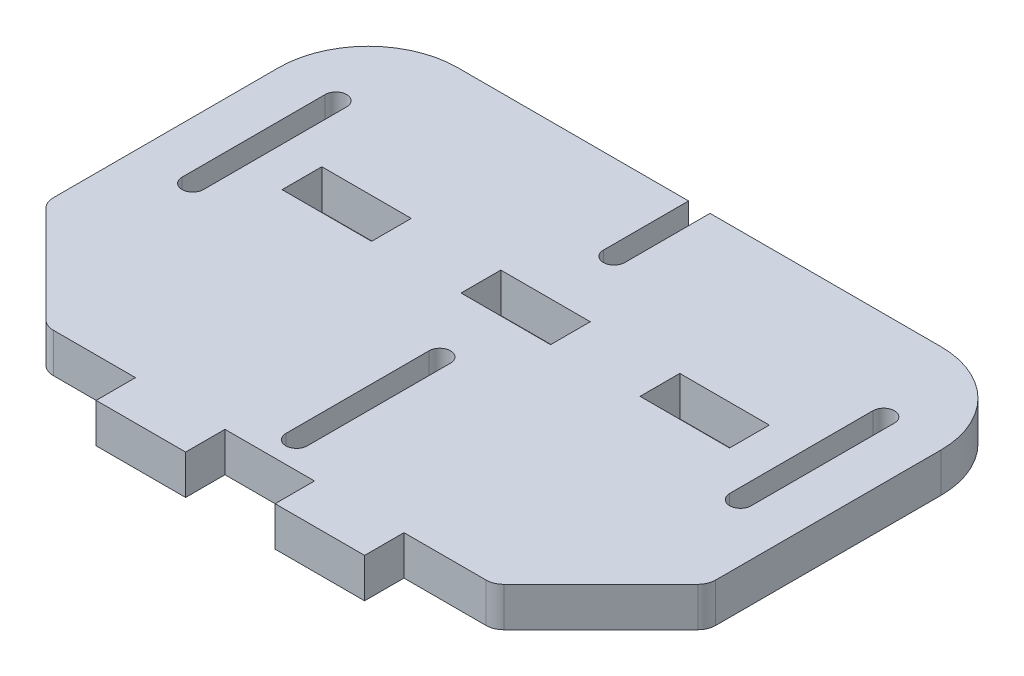
from build123d import *

# Parameters (mm, degrees)
BOSS_EXTRUDE6_DEPTH = 11
SKETCH4_W           = 25
SKETCH4_H           = 11
SKETCH4_H_2         = 11.1
CUT_EXTRUDE1_DEPTH  = 199.489924177
FILLET1_R           = 25
FILLET2_R           = 5


with BuildPart() as part:
    # Sketch1 → Boss-Extrude6 (new body)
    with BuildSketch(Plane(origin=(0, 0, 0), x_dir=(1, 0, 0), z_dir=(0, 1, 0))):
        with BuildLine():
            Line((0, -7.5), (125, -7.5))
            Line((125, -7.5), (125, 3.5))
            Line((125, 3.5), (155, 33.5))
            Line((155, 33.5), (155, 123.5))
            Line((155, 123.5), (65.5, 123.5))
            Line((65.5, 123.5), (65.5, 99.705746838))
            ThreePointArc((65.5, 99.705746838), (62.5, 96.705746838), (59.5, 99.705746838))
            Line((59.5, 99.705746838), (59.5, 123.5))
            Line((59.5, 123.5), (-30, 123.5))
            Line((-30, 123.5), (-30, 33.5))
            Line((-30, 33.5), (0, 3.5))
            Line((0, 3.5), (0, -7.5))
        make_face()
        with BuildLine():
            Line((136, 58.5), (136, 98.5))
            ThreePointArc((136, 98.5), (139, 101.5), (142, 98.5))
            Line((142, 98.5), (142, 58.5))
            ThreePointArc((142, 58.5), (139, 55.5), (136, 58.5))
        make_face(mode=Mode.SUBTRACT)
        with BuildLine():
            Line((-17, 58.5), (-17, 98.5))
            ThreePointArc((-17, 98.5), (-14, 101.5), (-11, 98.5))
            Line((-11, 98.5), (-11, 58.5))
            ThreePointArc((-11, 58.5), (-14, 55.5), (-17, 58.5))
        make_face(mode=Mode.SUBTRACT)
        with BuildLine():
            Line((59.5, 11), (59.5, 51))
            ThreePointArc((59.5, 51), (62.5, 54), (65.5, 51))
            Line((65.5, 51), (65.5, 11))
            ThreePointArc((65.5, 11), (62.5, 8), (59.5, 11))
        make_face(mode=Mode.SUBTRACT)
    extrude(amount=BOSS_EXTRUDE6_DEPTH)

    # Sketch4 → Cut-Extrude1 (cut, through all)
    with BuildSketch(Plane(origin=(0, 11, 0), x_dir=(1, 0, 0), z_dir=(0, 1, 0))):
        with Locations((12.5, -2)):
            Rectangle(SKETCH4_W, SKETCH4_H)
        with Locations((62.5, -2)):
            Rectangle(SKETCH4_W, SKETCH4_H)
        with Locations((12.5, 75)):
            Rectangle(SKETCH4_W, SKETCH4_H_2)
        with Locations((112.5, -2)):
            Rectangle(SKETCH4_W, SKETCH4_H)
        with Locations((62.5, 75)):
            Rectangle(SKETCH4_W, SKETCH4_H_2)
        with Locations((112.5, 75)):
            Rectangle(SKETCH4_W, SKETCH4_H_2)
    extrude(amount=-CUT_EXTRUDE1_DEPTH, mode=Mode.SUBTRACT)

    # Fillet1
    fillet1_edges = [part.edges().sort_by_distance(p)[0] for p in [
        (155, 5.5, -123.5),
        (-30, 5.5, -123.5),
    ]]
    fillet(fillet1_edges, radius=FILLET1_R)

    # Fillet2
    fillet2_edges = [part.edges().sort_by_distance(p)[0] for p in [
        (155, 5.5, -33.5),
        (125, 5.5, -3.5),
        (0, 5.5, -3.5),
        (-30, 5.5, -33.5),
    ]]
    fillet(fillet2_edges, radius=FILLET2_R)


solid = part.part
